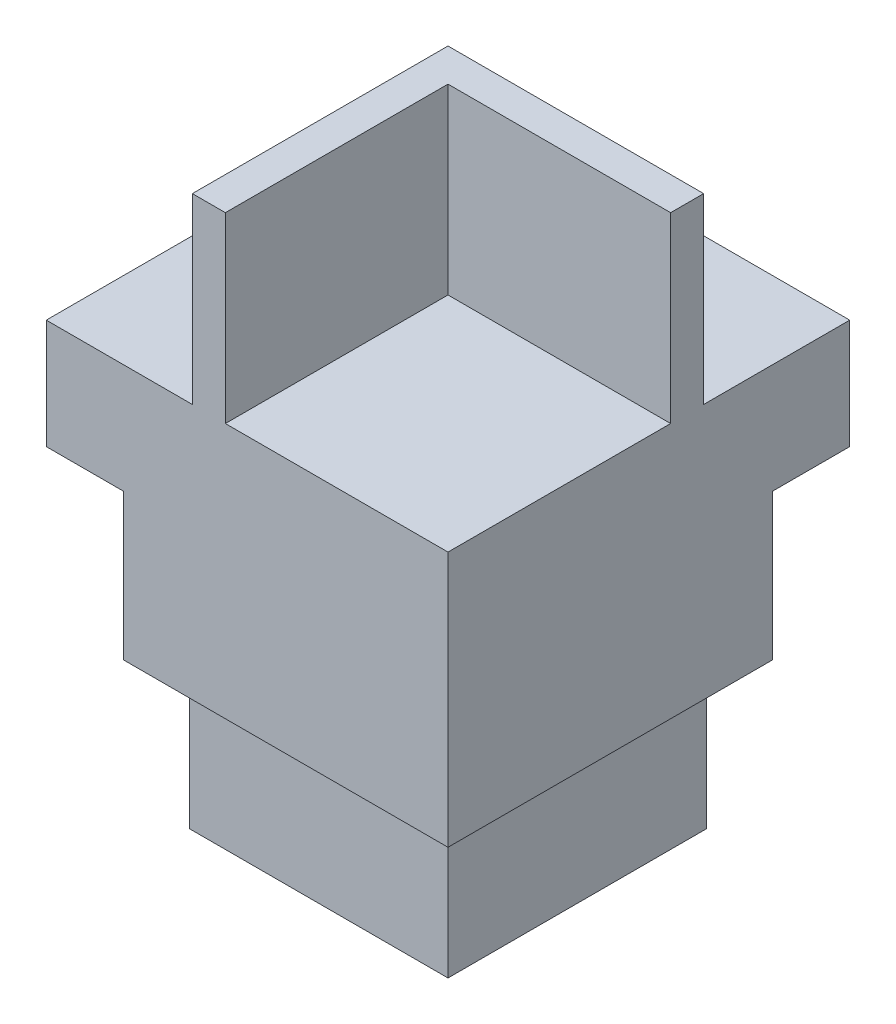
from build123d import *

# Parameters (mm, degrees)
SKETCH7_W           = 27.5
SKETCH7_H           = 27.5
BOSS_EXTRUDE6_DEPTH = 40
SKETCH8_W           = 15.24
SKETCH8_H           = 15.24
CUT_EXTRUDE2_DEPTH  = 12.5
CUT_EXTRUDE3_DEPTH  = 20
SKETCH10_W          = 22.2
SKETCH10_H          = 22.2
SKETCH10_W_2        = 17.7
SKETCH10_H_2        = 17.7
CUT_EXTRUDE4_DEPTH  = 10
CUT_EXTRUDE5_DEPTH  = 12.5


with BuildPart() as part:
    # Sketch7 → Boss-Extrude6 (new body)
    with BuildSketch(Plane(origin=(0, 0, 0), x_dir=(1, 0, 0), z_dir=(0, 1, 0))):
        with Locations((-1.790038454, -39.090727751)):
            Rectangle(SKETCH7_W, SKETCH7_H)
    extrude(amount=BOSS_EXTRUDE6_DEPTH)

    # Sketch8 → Cut-Extrude2 (cut)
    with BuildSketch(Plane(origin=(0, 40, 0), x_dir=(1, 0, 0), z_dir=(0, 1, 0))):
        with Locations((4.339961546, -45.220727751)):
            Rectangle(SKETCH8_W, SKETCH8_H)
    extrude(amount=-CUT_EXTRUDE2_DEPTH, mode=Mode.SUBTRACT)

    # Sketch9 → Cut-Extrude3 (cut)
    with BuildSketch(Plane.XZ):
        Polygon((-10.240038454, 30.640727751), (-10.240038454, 52.840727751), (-15.540038454, 52.840727751), (-15.540038454, 25.340727751), (11.959961546, 25.340727751), (11.959961546, 30.640727751), align=None)
    extrude(amount=-CUT_EXTRUDE3_DEPTH, mode=Mode.SUBTRACT)

    # Sketch10 → Cut-Extrude4 (cut)
    with BuildSketch(Plane.XZ):
        with Locations((0.859961546, 41.740727751)):
            Rectangle(SKETCH10_W, SKETCH10_H)
        with Locations((0.859961546, 41.740727751)):
            Rectangle(SKETCH10_W_2, SKETCH10_H_2, mode=Mode.SUBTRACT)
    extrude(amount=-CUT_EXTRUDE4_DEPTH, mode=Mode.SUBTRACT)

    # Sketch11 → Cut-Extrude5 (cut)
    with BuildSketch(Plane(origin=(0, 40, 0), x_dir=(1, 0, 0), z_dir=(0, 1, 0))):
        Polygon((11.959961546, -35.340727751), (11.959961546, -25.340727751), (-4.564600262, -25.340727751), (-10.557653768, -25.340727751), (-15.540038454, -25.340727751), (-15.540038454, -52.840727751), (-5.540038454, -52.840727751), (-5.540038454, -35.340727751), align=None)
    extrude(amount=-CUT_EXTRUDE5_DEPTH, mode=Mode.SUBTRACT)


solid = part.part
